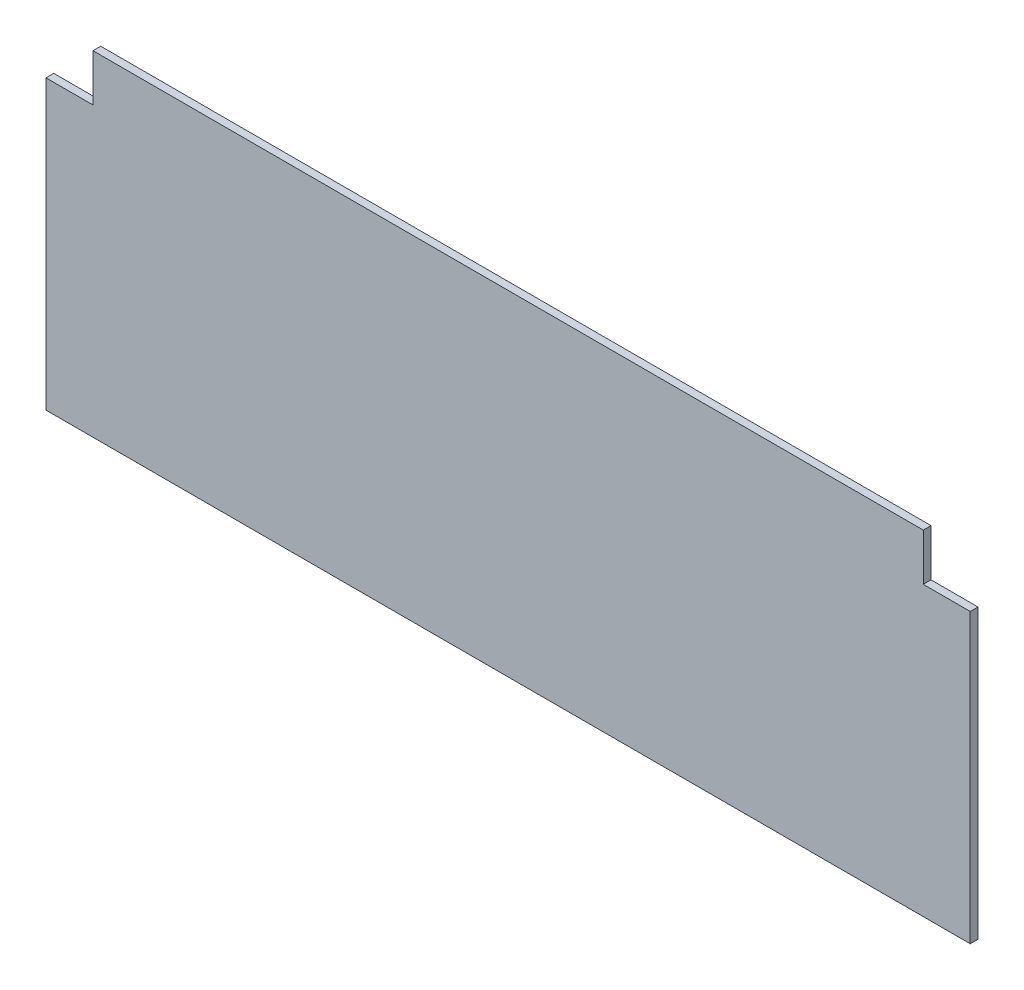
from build123d import *

# Parameters (mm, degrees)
BOSS_EXTRUDE1_DEPTH = 3.3


with BuildPart() as part:
    # Sketch1 → Boss-Extrude1 (new body)
    with BuildSketch(Plane.XY):
        Polygon((0, -162.304293747), (393.4, -162.304293747), (393.4, -39.804293747), (373.4, -39.804293747), (373.4, -19.804293747), (20, -19.804293747), (20, -39.804293747), (0, -39.804293747), align=None)
    extrude(amount=-BOSS_EXTRUDE1_DEPTH)


solid = part.part
